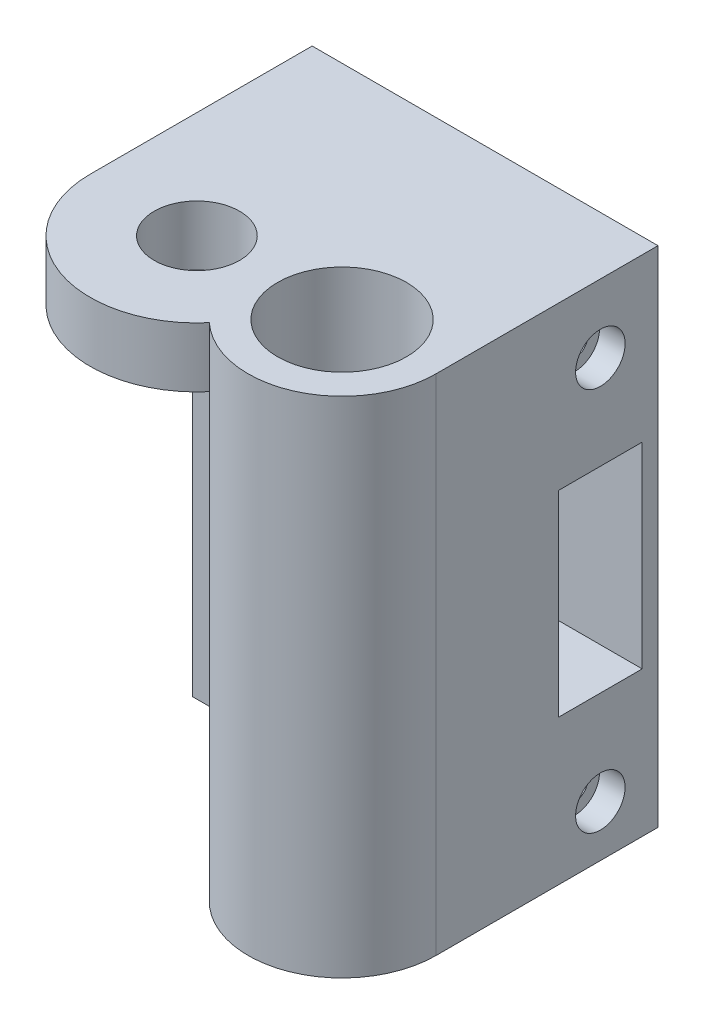
from build123d import *

# Parameters (mm, degrees)
CROQUIS1_R              = 5
CROQUIS1_R_2            = 7.55
SALIENTE_EXTRUIR1_DEPTH = 7
SALIENTE_EXTRUIR4_START = 52
CROQUIS4_R              = 7.55
SALIENTE_EXTRUIR4_DEPTH = 52
CROQUIS5_R              = 4.1
CORTAR_EXTRUIR1_DEPTH   = 35
CROQUIS6_W              = 9.8
CROQUIS6_H              = 23
CORTAR_EXTRUIR2_DEPTH   = 71.853722556
CROQUIS7_R              = 1.55
CORTAR_EXTRUIR3_DEPTH   = 71.853722556
CROQUIS8_R              = 2.9
CROQUIS8_R_2            = 1.55
CORTAR_EXTRUIR4_DEPTH   = 3
CROQUIS10_R             = 1.5
CORTAR_EXTRUIR5_DEPTH   = 64.939424458


with BuildPart() as part:
    # Croquis1 → Saliente-Extruir1 (new body)
    with BuildSketch(Plane(origin=(0, 0, 0), x_dir=(1, 0, 0), z_dir=(0, 1, 0))):
        with BuildLine():
            Line((28, 0), (28, 26))
            Line((28, 26), (-12.5, 26))
            Line((-12.5, 26), (-12.5, 0))
            ThreePointArc((-12.5, 0), (-4.303512587, -11.735833137), (9.536764706, -8.0808489))
            ThreePointArc((9.536764706, -8.0808489), (21.410465495, -10.077092543), (28, 0))
        make_face()
        Circle(CROQUIS1_R, mode=Mode.SUBTRACT)
        with Locations((17, 0)):
            Circle(CROQUIS1_R_2, mode=Mode.SUBTRACT)
    extrude(amount=SALIENTE_EXTRUIR1_DEPTH)

    # Croquis4 → Saliente-Extruir4 (add)
    with BuildSketch(Plane.XZ.offset(SALIENTE_EXTRUIR4_START)):
        with BuildLine():
            Line((-12.5, -12), (-12.5, -26))
            Line((-12.5, -26), (28, -26))
            Line((28, -26), (28, 0))
            ThreePointArc((28, 0), (21.410465495, 10.077092543), (9.536764706, 8.0808489))
            ThreePointArc((9.536764706, 8.0808489), (6.922907457, 4.410465495), (6, 0))
            Line((6, 0), (6, -12))
            Line((6, -12), (-12.5, -12))
        make_face()
        with Locations((17, 0)):
            Circle(CROQUIS4_R, mode=Mode.SUBTRACT)
    extrude(amount=-SALIENTE_EXTRUIR4_DEPTH)

    # Croquis5 → Cortar-Extruir1 (cut)
    with BuildSketch(Plane.ZY.offset(12.5)):
        with Locations((-19.25, -1)):
            Circle(CROQUIS5_R)
        with Locations((-19.25, -46)):
            Circle(CROQUIS5_R)
    extrude(amount=-CORTAR_EXTRUIR1_DEPTH, mode=Mode.SUBTRACT)

    # Croquis6 → Cortar-Extruir2 (cut, through all)
    with BuildSketch(Plane.ZY.offset(12.5)):
        with Locations((-19.25, -23.5)):
            Rectangle(CROQUIS6_W, CROQUIS6_H)
    extrude(amount=-CORTAR_EXTRUIR2_DEPTH, mode=Mode.SUBTRACT)

    # Croquis7 → Cortar-Extruir3 (cut, through all)
    with BuildSketch(Plane(origin=(28, 0, 0), x_dir=(0, 0, -1), z_dir=(1, 0, 0))):
        with Locations((19.25, -1)):
            Circle(CROQUIS7_R)
        with Locations((19.25, -46)):
            Circle(CROQUIS7_R)
    extrude(amount=-CORTAR_EXTRUIR3_DEPTH, mode=Mode.SUBTRACT)

    # Croquis8 → Cortar-Extruir4 (cut)
    # profile 1 of 2: a face of its own
    with BuildSketch(Plane(origin=(28, 0, 0), x_dir=(0, 0, -1), z_dir=(1, 0, 0))):
        with Locations((19.25, -1)):
            Circle(CROQUIS8_R)
        with Locations((19.25, -1)):
            Circle(CROQUIS8_R_2, mode=Mode.SUBTRACT)
    # profile 2 of 2: a face of its own
    with BuildSketch(Plane(origin=(28, 0, 0), x_dir=(0, 0, -1), z_dir=(1, 0, 0))):
        with Locations((19.25, -46)):
            Circle(CROQUIS8_R)
        with Locations((19.25, -46)):
            Circle(CROQUIS8_R_2, mode=Mode.SUBTRACT)
    extrude(amount=-CORTAR_EXTRUIR4_DEPTH, mode=Mode.SUBTRACT)

    # Croquis10 → Cortar-Extruir5 (cut, through all)
    with BuildSketch(Plane.XY.offset(-12)):
        with Locations((-5.5, -23.5)):
            Circle(CROQUIS10_R)
    extrude(amount=-CORTAR_EXTRUIR5_DEPTH, mode=Mode.SUBTRACT)


solid = part.part
